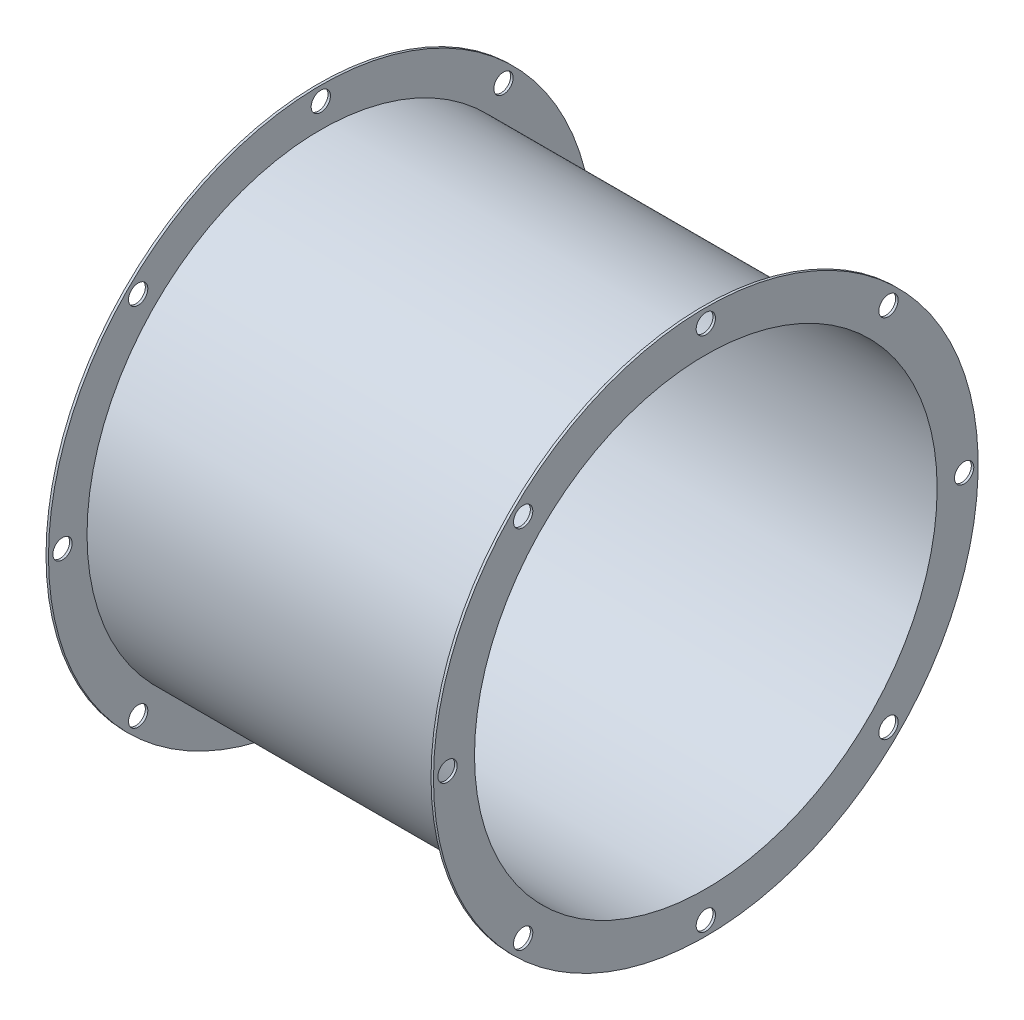
from build123d import *

# Parameters (mm, degrees)
SKETCH2_R          = 3.175
CUT_EXTRUDE1_DEPTH = 224.79
CIRPATTERN1_COUNT  = 8


with BuildPart() as part:
    # Sketch1 → Revolve1 (revolve)
    with BuildSketch(Plane.XY):
        Polygon((0, 76.2), (127.635, 76.2), (127.635, 89.7128), (126.8222, 89.7128), (126.8222, 77.0128), (0.8128, 77.0128), (0.8128, 89.7128), (0, 89.7128), align=None)
    revolve(axis=Axis((0, 0, 0), (1, 0, 0)))

    # Sketch2 → Cut-Extrude1 (cut)
    with BuildSketch(Plane(origin=(0, 0, 0), x_dir=(0, 0, -1), z_dir=(1, 0, 0))):
        with Locations((0, 85.09)):
            Circle(SKETCH2_R)
    cut_extrude1 = extrude(amount=CUT_EXTRUDE1_DEPTH, mode=Mode.SUBTRACT)

    # CirPattern1: Cut-Extrude1 ×8 about axis
    cirpattern1_axis = Axis((0, 0, 0), (-1, 0, 0))
    for i in range(1, CIRPATTERN1_COUNT):
        add(cut_extrude1.rotate(cirpattern1_axis, i * 360 / CIRPATTERN1_COUNT), mode=Mode.SUBTRACT)


solid = part.part
